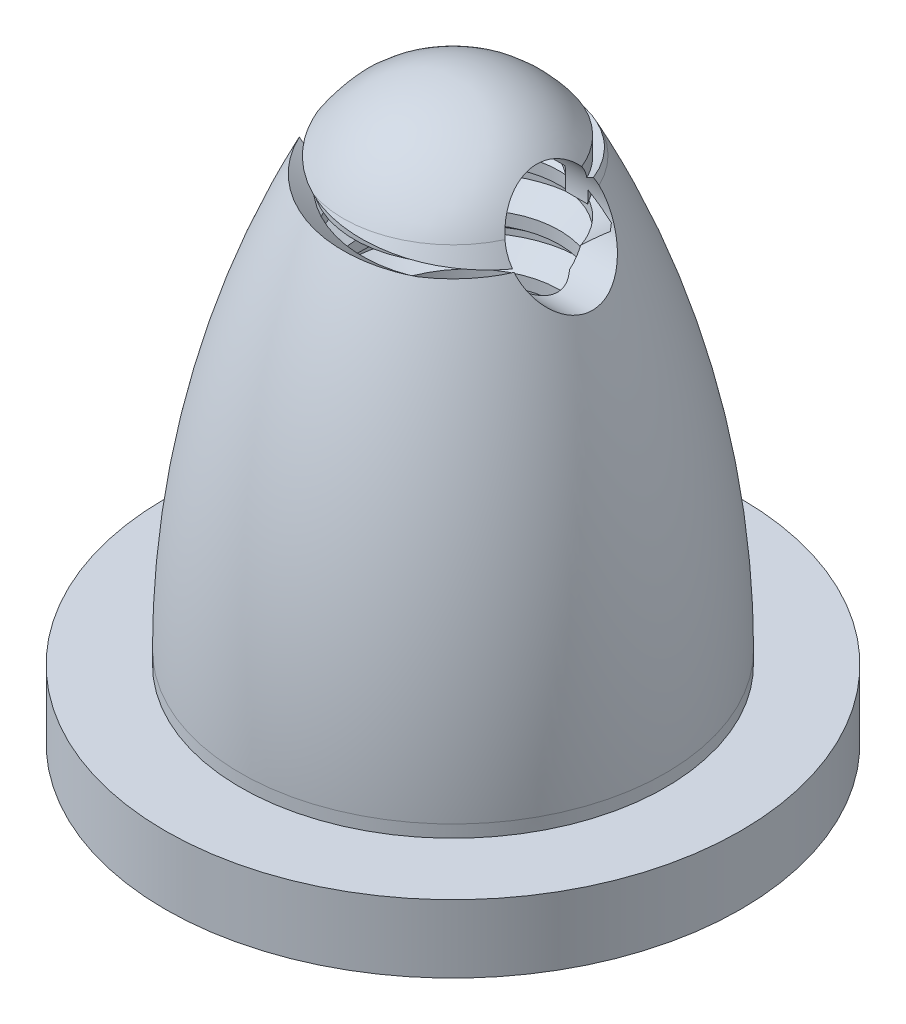
from build123d import *

# Parameters (mm, degrees)
CUT_EXTRUDE1_DEPTH      = 15.509638324
CUT_EXTRUDE1_DEPTH_BACK = 15.509638324
SKETCH2_R               = 1.016
CHAMFER2_SIZE           = 0.508
CUT_SWEEP1_PITCH        = 1.058333333


with BuildPart() as part:
    # Sketch1 → Revolve1 (revolve)
    with BuildSketch(Plane.XY, mode=Mode.PRIVATE) as revolve1_sk:
        with BuildLine():
            Line((5.9182, 0), (5.9182, 1.397))
            Line((5.9182, 1.397), (4.370759719, 1.397))
            Line((4.370759719, 1.397), (4.370759719, 1.651))
            ThreePointArc((4.370759719, 1.651), (3.834329425, 6.185830205), (2.254648853, 10.470343215))
            ThreePointArc((2.254648853, 10.470343215), (1.322263836, 11.479390728), (0, 11.85240152))
            Line((0, 11.85240152), (0, 10.470343215))
            Line((0, 10.470343215), (1.651, 10.470343215))
            Line((1.651, 10.470343215), (1.651, 9.986129864))
            Line((1.651, 9.986129864), (2.032, 9.986129864))
            Line((2.032, 9.986129864), (2.032, 0))
            Line((2.032, 0), (5.9182, 0))
        make_face()
    revolve(revolve1_sk.sketch.rotate(Axis((0, 11.85240152, 0), (0, -1, 0)), 180), axis=Axis((0, 11.85240152, 0), (0, -1, 0)))

    # Sketch2 → Cut-Extrude1 (cut, two sides: drawn at the far end of the back side and taken through both)
    with BuildSketch(Plane(origin=(0, 0, 0), x_dir=(0, 0, -1), z_dir=(1, 0, 0)).offset(-CUT_EXTRUDE1_DEPTH_BACK)):
        with Locations(Location((0, 10.16, 0), (0, 0, 17.785593896))):
            Circle(SKETCH2_R)
    extrude(amount=CUT_EXTRUDE1_DEPTH + CUT_EXTRUDE1_DEPTH_BACK, mode=Mode.SUBTRACT)

    # Chamfer2
    chamfer2_edges = [part.edges().sort_by_distance(p)[0] for p in [
        (2.032, 0, 0),
    ]]
    chamfer(chamfer2_edges, length=CHAMFER2_SIZE)

    # Cut-Sweep1: the profile of Sketch3 profile screwed along a left-hand helix of 10.8 turns, 8 arcs to a turn; built about Z, then put on its axis
    cut_sweep1_z = Axis((0, 0, 0), (0, 0, 1))
    cut_sweep1_corners = [(2.0317, 0, 0.000228571), (2.0317, 0, -0.804561905), (2.4765, 0, -0.465666667), (2.4765, 0, -0.338666667)]
    with BuildLine(mode=Mode.PRIVATE) as cut_sweep1_profile:
        Line(cut_sweep1_corners[0], cut_sweep1_corners[1])
        Line(cut_sweep1_corners[1], cut_sweep1_corners[2])
        Line(cut_sweep1_corners[2], cut_sweep1_corners[3])
        Line(cut_sweep1_corners[3], cut_sweep1_corners[0])
    cut_sweep1_cap = Face(cut_sweep1_profile.wire())
    cut_sweep1_turn_angles = [0, -22.5, -45, -67.5, -90, -112.5, -135, -157.5, -180, -202.5, -225, -247.5, -270, -292.5, -315, -337.5, -360]
    cut_sweep1_turn_weights = [1, 0.9238795325112867, 1, 0.9238795325112867, 1, 0.9238795325112867, 1, 0.9238795325112867, 1, 0.9238795325112867, 1, 0.9238795325112867, 1, 0.9238795325112867, 1, 0.9238795325112867, 1]
    cut_sweep1_turn_rails = [Edge.make_bspline([Vector(p[0], p[1], 0).rotate(cut_sweep1_z, cut_sweep1_turn_angles[k]) / cut_sweep1_turn_weights[k] + Vector(0, 0, p[2] + -CUT_SWEEP1_PITCH * cut_sweep1_turn_angles[k] / 360) for k in range(17)], [0, 0, 0, 1, 1, 2, 2, 3, 3, 4, 4, 5, 5, 6, 6, 7, 7, 8, 8, 8], 2, cut_sweep1_turn_weights) for p in cut_sweep1_corners]
    cut_sweep1_turn_sides = [Face.make_surface_from_curves(cut_sweep1_turn_rails[p[0]], cut_sweep1_turn_rails[p[1]]) for p in [(0, 1), (1, 2), (2, 3), (3, 0)]]
    cut_sweep1_last_angles = [-3600, -3622.5, -3645, -3667.5, -3690, -3712.5, -3735, -3757.5, -3780, -3802.5, -3825, -3847.5, -3870, -3879, -3888]
    cut_sweep1_last_weights = [1, 0.9238795325112867, 1, 0.9238795325112867, 1, 0.9238795325112867, 1, 0.9238795325112867, 1, 0.9238795325112867, 1, 0.9238795325112867, 1, 0.9876883405951203, 1]
    cut_sweep1_last_rails = [Edge.make_bspline([Vector(p[0], p[1], 0).rotate(cut_sweep1_z, cut_sweep1_last_angles[k]) / cut_sweep1_last_weights[k] + Vector(0, 0, p[2] + -CUT_SWEEP1_PITCH * cut_sweep1_last_angles[k] / 360) for k in range(15)], [0, 0, 0, 1, 1, 2, 2, 3, 3, 4, 4, 5, 5, 6, 6, 7, 7, 7], 2, cut_sweep1_last_weights) for p in cut_sweep1_corners]
    cut_sweep1_last_sides = [Face.make_surface_from_curves(cut_sweep1_last_rails[p[0]], cut_sweep1_last_rails[p[1]]) for p in [(0, 1), (1, 2), (2, 3), (3, 0)]]
    cut_sweep1 = Plane(origin=(0, 0, 0), x_dir=(0, 0, 1), z_dir=(0, 1, 0)) * Solid(Shell([*[p.moved(Location((0, 0, CUT_SWEEP1_PITCH * i))) for i in range(10) for p in cut_sweep1_turn_sides], *cut_sweep1_last_sides, cut_sweep1_cap, cut_sweep1_cap.rotate(cut_sweep1_z, -3888).moved(Location((0, 0, -CUT_SWEEP1_PITCH * -3888 / 360)))]))
    add(cut_sweep1, mode=Mode.SUBTRACT)


solid = part.part
